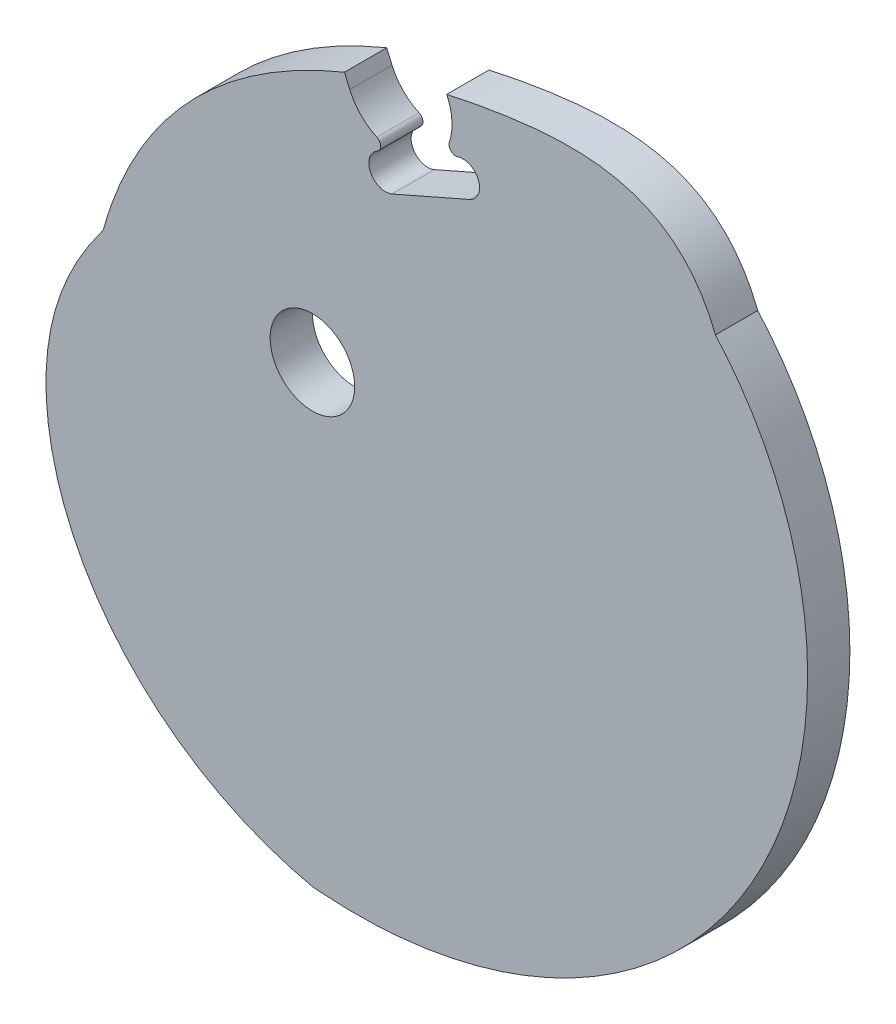
from build123d import *

# Parameters (mm, degrees)
SKETCH1_R           = 6.35
BOSS_EXTRUDE1_DEPTH = 3.175
FILLET3_R           = 1


with BuildPart() as part:
    # Sketch1 → Boss-Extrude1 (new, symmetric)
    with BuildSketch(Plane.XY):
        with BuildLine():
            ThreePointArc((11.984914181, 27.895733584), (8.691133377, 29.180649151), (9.976048944, 32.474429955))
            Line((9.976048944, 32.474429955), (12.234616787, 33.465357952))
            ThreePointArc((12.234616787, 33.465357952), (8.260068693, 34.969173795), (5.615202157, 38.295309036))
            Line((5.615202157, 38.295309036), (4.817017743, 40.166741189))
            add(Edge.make_bspline(
                [(4.817017743, 40.166741189), (-12.318313017, 33.133186073), (-26.082330189, 20.886296157), (-31.434854064, 1.476615471)],
                knots=[0.525970045, 0.525970045, 0.525970045, 0.525970045, 1, 1, 1, 1], degree=3))
            add(Edge.make_bspline(
                [(-31.434854064, 1.476615471), (-31.527195505, 1.353858054), (-31.754298965, 1.049739376), (-32.114304, 0.558316675), (-32.5147745, -0.002107391), (-32.914270808, -0.576495389), (-33.311891924, -1.165119679), (-33.706725269, -1.768206694), (-34.097848502, -2.385936616), (-34.484331346, -3.018443117), (-34.865237427, -3.665813149), (-35.239626109, -4.328086807), (-35.606554333, -5.005257241), (-35.965078463, -5.697270632), (-36.433186951, -6.644749058), (-36.877778588, -7.616227649), (-37.403538549, -8.865808487), (-37.89844649, -10.15596349), (-38.339644059, -11.47844157), (-38.659981536, -12.561345718), (-38.883742195, -13.388599922), (-39.089211509, -14.227060001), (-39.27554788, -15.076191498), (-39.498552768, -16.225715183), (-39.726946666, -17.686700696), (-39.917996988, -19.468580741), (-40.024782444, -21.280969713), (-40.045341441, -23.119742437), (-39.9779185, -24.980664299), (-39.820968297, -26.859401742), (-39.573161339, -28.751532609), (-39.233388685, -30.652556865), (-38.800766241, -32.557907545), (-38.274638487, -34.462961931), (-37.654581673, -36.363052938), (-36.940406441, -38.253480666), (-36.132159895, -40.129524105), (-35.230127076, -41.986452952), (-34.234831872, -43.819539532), (-33.147037329, -45.624070773), (-31.967745371, -47.395360218), (-30.69819593, -49.128760047), (-29.339865478, -50.819673076), (-27.894464961, -52.463564698), (-26.363937143, -54.055974755), (-24.750453354, -55.592529291), (-23.05640966, -57.068952172), (-21.284422438, -58.481076539), (-19.437323392, -59.824856061), (-17.518153991, -61.09637597), (-15.53015936, -62.291863846), (-13.476781624, -63.407700126), (-11.361652741, -64.440428475), (-9.553831313, -65.227709289), (-8.080597677, -65.813060218), (-6.960835983, -66.230097397), (-5.828609099, -66.623940834), (-4.684517393, -66.994692102), (-3.528855098, -67.340343758), (-2.363108933, -67.666857115), (-1.184337898, -67.950379167), (-0.01402302, -68.276721004), (1.19496178, -68.321277307), (2.388869047, -68.414812178), (3.588916798, -68.47013668), (4.791045471, -68.510536097), (5.995946941, -68.529549806), (7.203027199, -68.528714145), (8.412028292, -68.507423656), (10.433152978, -68.437688056), (12.861297544, -68.271113035), (15.690066279, -67.954769994), (18.114395708, -67.598393542), (20.533178068, -67.156262739), (22.94320403, -66.627739384), (25.34117249, -66.012319379), (27.72369681, -65.309640519), (30.087311662, -64.519489877), (32.428480366, -63.641810853), (34.743602713, -62.676709846), (37.029023257, -61.624462503), (39.281040057, -60.485519541), (41.495913836, -59.26051209), (43.669877536, -57.950256553), (45.799146255, -56.555758944), (47.879927513, -55.078218686), (49.908431845, -53.519031845), (51.880883673, -51.879793783), (53.793532432, -50.162301209), (55.642663916, -48.368553607), (57.424611814, -46.500754037), (59.135769398, -44.561309278), (60.772601325, -42.552829318), (62.331655529, -40.478126172), (63.809575152, -38.340212016), (65.203110484, -36.142296645), (66.509130877, -33.887784231), (67.724636585, -31.580269399), (68.846770509, -29.223532602), (69.872829789, -26.821534809), (70.800277214, -24.378411507), (71.626752419, -21.898466018), (72.350082814, -19.386162143), (72.968294223, -16.846116143), (73.479621181, -14.283088065), (73.882516868, -11.701972429), (74.175662624, -9.107788295), (74.35797703, -6.505668721), (74.428624501, -3.900849636), (74.387023371, -1.298658146), (74.232853422, 1.295499691), (73.966062842, 3.876151621), (73.586874568, 6.437772425), (73.095791985, 8.974797617), (72.493603959, 11.481637571), (71.781389173, 13.952692039), (70.960519734, 16.382365041), (70.032664043, 18.765080076), (68.999788887, 21.095295628), (67.864160745, 23.367520924), (66.628346286, 25.576331908), (65.295212039, 27.716387387), (63.867923223, 29.782445306), (62.349941726, 31.769379124), (61.22405744, 33.104244186), (60.617225546, 33.785688077), (60.561937131, 33.847469547)],
                knots=[0.746012314, 0.746012314, 0.746012314, 0.746012314, 0.747290584, 0.749170776, 0.751081502, 0.753022336, 0.754992805, 0.756992401, 0.759020578, 0.761076761, 0.763160347, 0.76527071, 0.767407202, 0.769569155, 0.771755887, 0.776200882, 0.778457713, 0.783036392, 0.787696808, 0.790055792, 0.792432952, 0.794827532, 0.797238799, 0.799666426, 0.804570687, 0.809540165, 0.814574675, 0.819673984, 0.824837811, 0.830065834, 0.835357687, 0.840712962, 0.84613121, 0.851611942, 0.857154631, 0.862758708, 0.868423573, 0.874148584, 0.879933066, 0.885776307, 0.891677564, 0.897636058, 0.903650977, 0.909721476, 0.915846682, 0.922025687, 0.928257554, 0.934541315, 0.940875975, 0.947260508, 0.95369386, 0.960174949, 0.966702667, 0.973275876, 0.976579178, 0.979893415, 0.983218438, 0.986554095, 0.989900235, 0.993256703, 0.996623344, 1, 1.003319606, 1.00664483, 1.00997572, 1.013312315, 1.016654652, 1.020002764, 1.023356679, 1.026716422, 1.036830797, 1.043603114, 1.050398984, 1.057218364, 1.064061153, 1.070927192, 1.077816264, 1.084728096, 1.09166236, 1.098618675, 1.105596607, 1.112595671, 1.119615332, 1.126655005, 1.133714056, 1.140791804, 1.147887524, 1.155000443, 1.162129745, 1.169274569, 1.176434014, 1.183607137, 1.190792953, 1.197990441, 1.205198539, 1.212416148, 1.219642135, 1.226875331, 1.234114533, 1.241358506, 1.248605983, 1.255855669, 1.263106241, 1.270356345, 1.277604607, 1.284849627, 1.292089983, 1.299324234, 1.306550921, 1.313768569, 1.320975689, 1.328170782, 1.335352341, 1.342518853, 1.349668803, 1.356800674, 1.363912958, 1.37100415, 1.37807276, 1.385117313, 1.392136355, 1.399128458, 1.406092224, 1.413026294, 1.419929348, 1.420619252, 1.420619252, 1.420619252, 1.420619252], degree=3))
            add(Edge.make_bspline(
                [(60.561937131, 33.847469547), (54.845801337, 48.446027811), (38.415683117, 48.488850835), (22.815960401, 45.553267169), (20.179716664, 44.956820308)],
                knots=[0, 0, 0, 0, 0.323798127, 0.390810822, 0.390810822, 0.390810822, 0.390810822], degree=3))
            Line((20.179716664, 44.956820308), (20.341961861, 44.576418389))
            ThreePointArc((20.341961861, 44.576418389), (20.922430294, 40.447066038), (19.347369883, 36.586019659))
            Line((19.347369883, 36.586019659), (21.605937727, 37.576947657))
            ThreePointArc((21.605937727, 37.576947657), (24.899718531, 36.29203209), (23.614802964, 32.998251286))
            Line((23.614802964, 32.998251286), (11.984914181, 27.895733584))
        make_face()
        Circle(SKETCH1_R, mode=Mode.SUBTRACT)
    extrude(amount=BOSS_EXTRUDE1_DEPTH, both=True)

    # Fillet3
    fillet3_edges = [part.edges().sort_by_distance(p)[0] for p in [
        (19.347369883, 36.586019659, 0),
        (12.234616787, 33.465357952, 0),
    ]]
    fillet(fillet3_edges, radius=FILLET3_R)


solid = part.part
